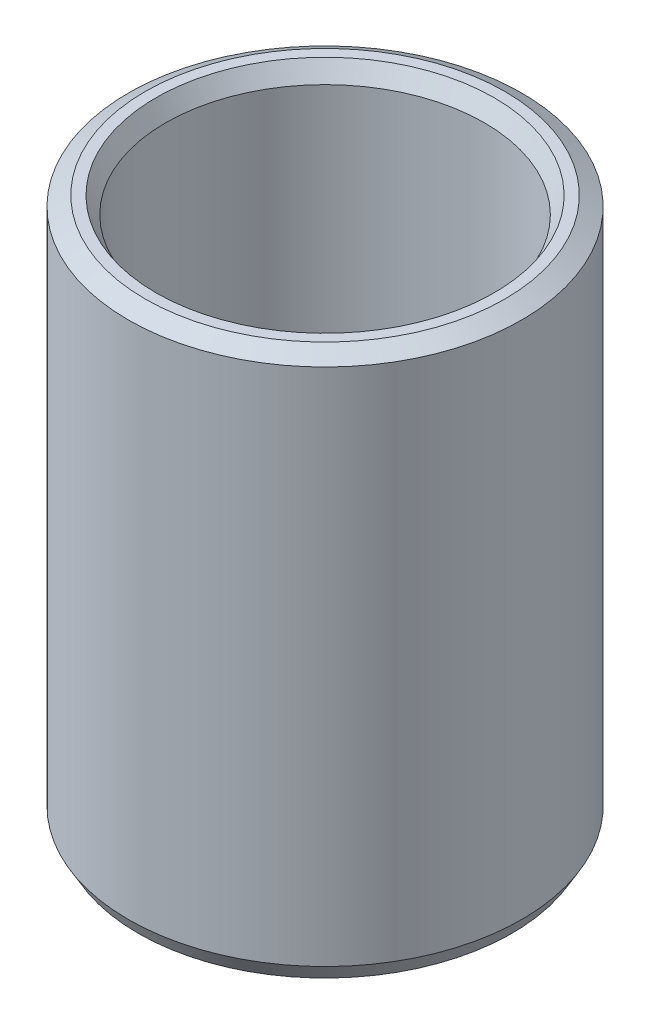
from build123d import *
from OCP.BRepFilletAPI import BRepFilletAPI_MakeChamfer

# Parameters (mm, degrees)
SKETCH1_R           = 50
BOSS_EXTRUDE1_DEPTH = 138.77086799
SKETCH2_R           = 40.513376048
CUT_EXTRUDE1_DEPTH  = 156.747724871
CHAMFER1_SIZE       = 2.471831388
CHAMFER1_SIZE2      = 4.281337552


with BuildPart() as part:
    # Sketch1 → Boss-Extrude1 (new body)
    with BuildSketch(Plane(origin=(0, 0, 0), x_dir=(1, 0, 0), z_dir=(0, 1, 0))):
        Circle(SKETCH1_R)
    extrude(amount=BOSS_EXTRUDE1_DEPTH)

    # Sketch2 → Cut-Extrude1 (cut, through all)
    with BuildSketch(Plane(origin=(0, 0, 0), x_dir=(1, 0, 0), z_dir=(0, 1, 0))):
        Circle(SKETCH2_R)
    extrude(amount=CUT_EXTRUDE1_DEPTH, mode=Mode.SUBTRACT)

    # Chamfer1: one chamfer whose edges measure the first distance from different faces: ONE call of the kernel's chamfer builder (chamfer() names one face for all edges)
    chamfer1_edges_1 = [part.edges().sort_by_distance(p)[0] for p in [
        (-40.513376048, 138.77086799, 0),
    ]]
    chamfer1_side_1 = [part.faces().sort_by_distance(p)[0] for p in [
        (-48.585786438, 138.77086799, 0),
    ]]
    chamfer1_edges_2 = [part.edges().sort_by_distance(p)[0] for p in [
        (-40.513376048, 0, 0),
    ]]
    chamfer1_side_2 = [part.faces().sort_by_distance(p)[0] for p in [
        (-40.513376048, 69.385433995, 0),
    ]]
    chamfer1_edges_3 = [part.edges().sort_by_distance(p)[0] for p in [
        (-50, 0, 0),
    ]]
    chamfer1_side_3 = [part.faces().sort_by_distance(p)[0] for p in [
        (-48.585786438, 0, 0),
    ]]
    chamfer1_edges_4 = [part.edges().sort_by_distance(p)[0] for p in [
        (-50, 138.77086799, 0),
    ]]
    chamfer1_side_4 = [part.faces().sort_by_distance(p)[0] for p in [
        (-50, 69.385433995, 0),
    ]]
    chamfer1 = BRepFilletAPI_MakeChamfer(part.part.solid().wrapped)
    for e in chamfer1_edges_1:
        chamfer1.Add(CHAMFER1_SIZE, CHAMFER1_SIZE2, e.wrapped, chamfer1_side_1[0].wrapped)  # the first distance lies on this face
    for e in chamfer1_edges_2:
        chamfer1.Add(CHAMFER1_SIZE, CHAMFER1_SIZE2, e.wrapped, chamfer1_side_2[0].wrapped)  # the first distance lies on this face
    for e in chamfer1_edges_3:
        chamfer1.Add(CHAMFER1_SIZE, CHAMFER1_SIZE2, e.wrapped, chamfer1_side_3[0].wrapped)  # the first distance lies on this face
    for e in chamfer1_edges_4:
        chamfer1.Add(CHAMFER1_SIZE, CHAMFER1_SIZE2, e.wrapped, chamfer1_side_4[0].wrapped)  # the first distance lies on this face
    add(Compound.cast(chamfer1.Shape()), mode=Mode.REPLACE)


solid = part.part
